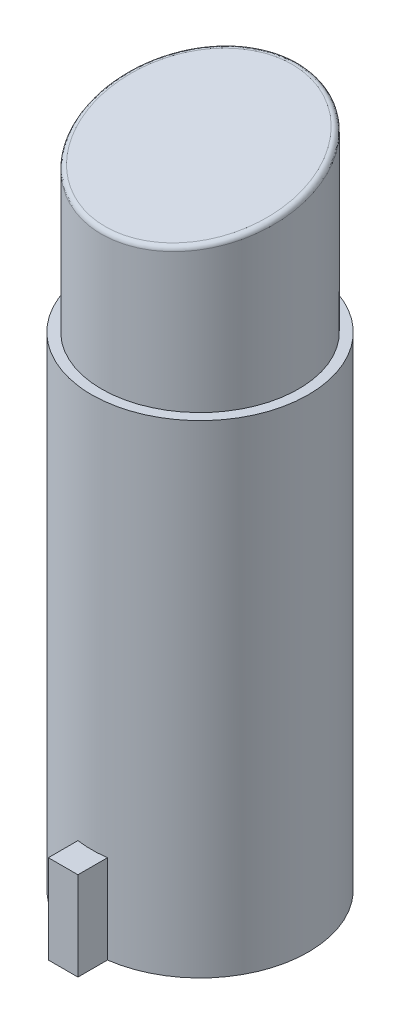
from build123d import *

# Parameters (mm, degrees)
SKETCH_1_R               = 11
EXTRUDE_1_DEPTH          = 68
CUT_EXTRUDE_START        = -19
SKETCH_2_R               = 11
SKETCH_2_R_2             = 10
CUT_EXTRUDE_1_DEPTH      = 19
CUT_EXTRUDE_2_DEPTH      = 70.756720106
CUT_EXTRUDE_2_DEPTH_BACK = 70.756720106
FILLET_1_R               = 0.5
SHELL_2_T                = -1
SKETCH_5_W               = 3
SKETCH_5_H               = 3
EXTRUDE_2_DEPTH          = 9


with BuildPart() as part:
    # ｽｹｯﾁ1 → ﾎﾞｽ - 押し出し1 (new body)
    with BuildSketch(Plane(origin=(0, 0, 0), x_dir=(1, 0, 0), z_dir=(0, 1, 0))):
        Circle(SKETCH_1_R)
    extrude(amount=EXTRUDE_1_DEPTH)

    # ｽｹｯﾁ2 → ｶｯﾄ - 押し出し1 (cut)
    with BuildSketch(Plane(origin=(0, 68, 0), x_dir=(1, 0, 0), z_dir=(0, 1, 0)).offset(CUT_EXTRUDE_START)):
        Circle(SKETCH_2_R)
        Circle(SKETCH_2_R_2, mode=Mode.SUBTRACT)
    extrude(amount=CUT_EXTRUDE_1_DEPTH, mode=Mode.SUBTRACT)

    # ｽｹｯﾁ3 → ｶｯﾄ - 押し出し2 (cut, two sides: drawn at the far end of the back side and taken through both)
    with BuildSketch(Plane(origin=(0, 0, 0), x_dir=(0, 0, -1), z_dir=(1, 0, 0)).offset(-CUT_EXTRUDE_2_DEPTH_BACK)):
        Polygon((-10, 63), (10, 68), (-10, 68), align=None)
    extrude(amount=CUT_EXTRUDE_2_DEPTH + CUT_EXTRUDE_2_DEPTH_BACK, mode=Mode.SUBTRACT)

    # ﾌｨﾚｯﾄ1
    fillet_1_edges = [part.edges().sort_by_distance(p)[0] for p in [
        (-10, 65.500000009, -3.7e-08),
    ]]
    fillet(fillet_1_edges, radius=FILLET_1_R)

    # ｼｪﾙ2
    shell_2_openings = [part.faces().sort_by_distance(p)[0] for p in [
        (0, 0, 0),
    ]]
    offset(amount=SHELL_2_T, openings=shell_2_openings, kind=Kind.INTERSECTION)

    # ｽｹｯﾁ5 → ﾎﾞｽ - 押し出し2 (add)
    with BuildSketch(Plane.XZ):
        with Locations((0, 12.397247359)):
            Rectangle(SKETCH_5_W, SKETCH_5_H)
    extrude(amount=-EXTRUDE_2_DEPTH)


solid = part.part
